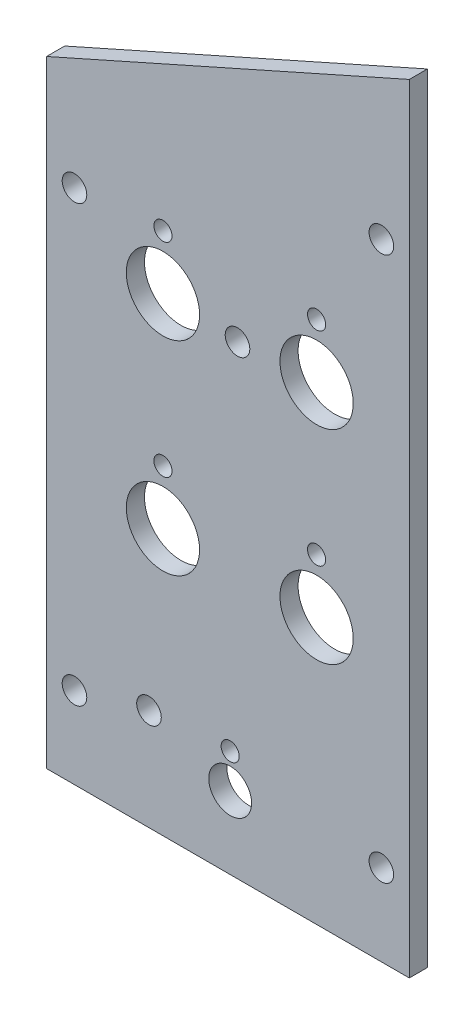
from build123d import *

# Parameters (mm, degrees)
BOSS_EXTRUDE1_DEPTH   = 3.175
F_6_CLEARANCE_HOLE1_D = 4.3053
SKETCH8_R             = 1.5875
SKETCH8_R_2           = 3.75
SKETCH8_R_3           = 6.4135
CUT_EXTRUDE1_DEPTH    = 151.327221464
F_6_CLEARANCE_HOLE2_D = 4.3053


with BuildPart() as part:
    # Sketch1 → Boss-Extrude1 (new body)
    with BuildSketch(Plane.XY):
        Polygon((0, 107.95), (0, 0), (63.5, 0), (63.5, 136.2202), align=None)
    extrude(amount=-BOSS_EXTRUDE1_DEPTH)

    # #6 Clearance Hole1 (through all)
    with Locations(Plane.XY):
        with Locations((58.6105, 14.2875), (4.8895, 14.2875), (4.8895, 90.4875), (58.6105, 109.5375)):
            Hole(F_6_CLEARANCE_HOLE1_D / 2)

    # Sketch8 → Cut-Extrude1 (cut, through all)
    with BuildSketch(Plane.XY):
        with Locations((20.373230618, 91.71042385)):
            Circle(SKETCH8_R)
        with Locations((47.270485986, 91.71042385)):
            Circle(SKETCH8_R)
        with Locations((47.270485986, 56.073006151)):
            Circle(SKETCH8_R)
        with Locations((32.1439032, 12.7)):
            Circle(SKETCH8_R_2)
        with Locations((20.373230618, 56.073006151)):
            Circle(SKETCH8_R)
        with Locations((32.1439032, 18.7)):
            Circle(SKETCH8_R)
        with Locations((47.270485986, 46.548006151)):
            Circle(SKETCH8_R_3)
        with Locations((47.270485986, 82.18542385)):
            Circle(SKETCH8_R_3)
        with Locations((20.373230618, 82.18542385)):
            Circle(SKETCH8_R_3)
        with Locations((20.373230618, 46.548006151)):
            Circle(SKETCH8_R_3)
    extrude(amount=-CUT_EXTRUDE1_DEPTH, mode=Mode.SUBTRACT)

    # #6 Clearance Hole2 (through all)
    with Locations(Plane(origin=(31.75, 0, 4.765), x_dir=(1, 0, 0), z_dir=(0, 0, 1))):
        with Locations((1.676331213, 81.383391323), (-13.818696068, 17.771227958)):
            Hole(F_6_CLEARANCE_HOLE2_D / 2)


solid = part.part
